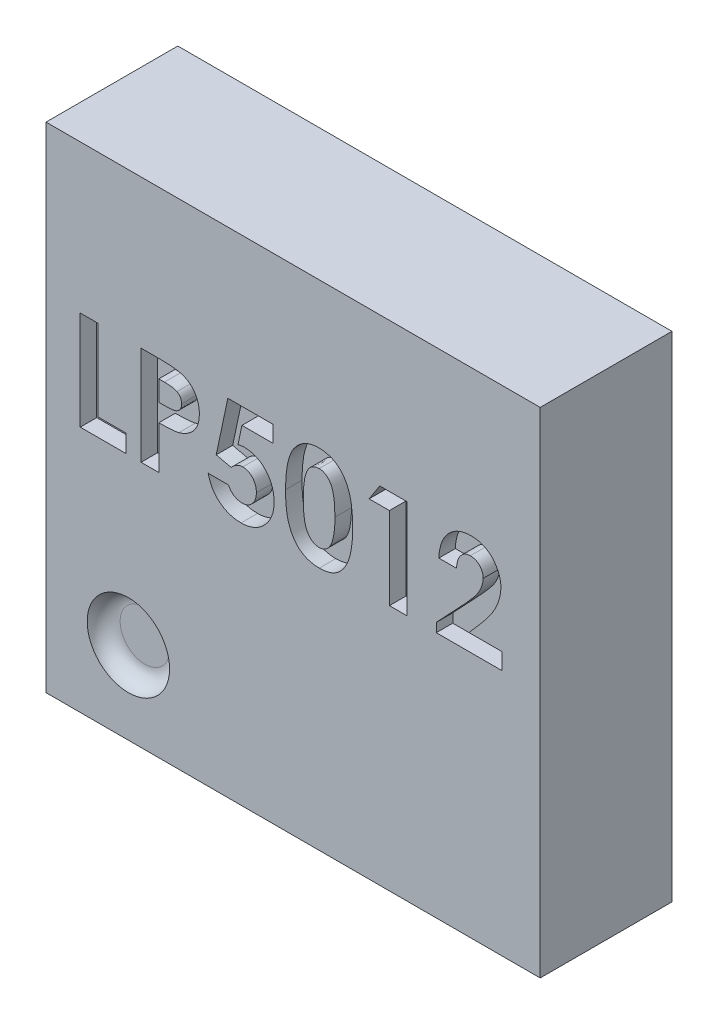
from build123d import *

# Parameters (mm, degrees)
CROQUIS1_W              = 3
CROQUIS1_H              = 3
SALIENTE_EXTRUIR1_DEPTH = 0.8
CROQUIS2_R              = 0.25
CORTAR_EXTRUIR1_DEPTH   = 0.1
REDONDEO1_R             = 0.1


with BuildPart() as part:
    # Croquis1 → Saliente-Extruir1 (new body)
    with BuildSketch(Plane.XY):
        Rectangle(CROQUIS1_W, CROQUIS1_H)
    extrude(amount=SALIENTE_EXTRUIR1_DEPTH)

    # Croquis2 → Cortar-Extruir1 (cut)
    # profile 1 of 7: a face of its own
    with BuildSketch(Plane.XY.offset(0.8)):
        with Locations((-1, -1)):
            Circle(CROQUIS2_R)
    # profile 2 of 7: a face of its own
    with BuildSketch(Plane.XY.offset(0.8)):
        Polygon((-1.292307692, 0.6), (-1.184615385, 0.6), (-1.184615385, 0.107692308), (-1.015384615, 0.107692308), (-1.015384615, 0), (-1.292307692, 0), align=None)
    # profile 3 of 7: a face of its own
    with BuildSketch(Plane.XY.offset(0.8)):
        with BuildLine():
            Line((-0.923076923, 0.6), (-0.802884615, 0.6))
            add(Edge.make_bspline(
                [(-0.802884615, 0.6), (-0.795031406, 0.599964847), (-0.779880919, 0.599897031), (-0.75803267, 0.599074662), (-0.73787659, 0.597600926), (-0.719417311, 0.595779623), (-0.702662422, 0.593226226), (-0.687590942, 0.590298956), (-0.674199742, 0.586732689), (-0.662337817, 0.58249958), (-0.651692122, 0.57750891), (-0.641617862, 0.57219349), (-0.632342714, 0.565849724), (-0.623398536, 0.559161316), (-0.61529668, 0.551489325), (-0.607531704, 0.543344333), (-0.600432478, 0.534403315), (-0.593966104, 0.524774502), (-0.588100106, 0.514635792), (-0.582975179, 0.503969061), (-0.578818124, 0.492757428), (-0.575330872, 0.481073421), (-0.572529878, 0.468917549), (-0.570665447, 0.456215053), (-0.569399031, 0.443054625), (-0.569287288, 0.434097629), (-0.569230769, 0.429567308)],
                knots=[0, 0, 0, 0, 1.698747864, 3.27724071, 4.728299578, 6.070144658, 7.288476769, 8.393259625, 9.389771311, 10.283485332, 11.113357557, 11.931608583, 12.74405601, 13.541433047, 14.344816069, 15.154114104, 15.974336324, 16.810834471, 17.661136416, 18.50621059, 19.367396281, 20.244825668, 21.142564693, 22.063065223, 23.020325768, 24, 24, 24, 24], degree=3))
            add(Edge.make_bspline(
                [(-0.569230769, 0.429567308), (-0.569312544, 0.424555521), (-0.569473242, 0.414706743), (-0.5710486, 0.400269644), (-0.573739808, 0.386505177), (-0.577257077, 0.373297264), (-0.582161659, 0.360863204), (-0.587764912, 0.348906318), (-0.594658692, 0.337761838), (-0.602535937, 0.327290363), (-0.611138788, 0.317406752), (-0.620671474, 0.308396377), (-0.630952301, 0.300197815), (-0.641921755, 0.292725144), (-0.653621018, 0.285993438), (-0.66604165, 0.279939661), (-0.679268466, 0.274757433), (-0.688479223, 0.272047169), (-0.693149038, 0.270673077)],
                knots=[0, 0, 0, 0, 1.102006807, 2.165578795, 3.188629044, 4.184801286, 5.166646146, 6.124351954, 7.085497154, 8.042432466, 9.003981491, 9.963833307, 10.922997304, 11.89326795, 12.880200226, 13.889073926, 14.929769137, 16, 16, 16, 16], degree=3))
            add(Edge.make_bspline(
                [(-0.693149038, 0.270673077), (-0.696224848, 0.269907811), (-0.702888041, 0.268249997), (-0.713913796, 0.266566901), (-0.726619821, 0.265019397), (-0.741047203, 0.263689505), (-0.757204259, 0.262785488), (-0.775075346, 0.262079491), (-0.794668562, 0.261566158), (-0.80829291, 0.261547943), (-0.815384615, 0.261538462)],
                knots=[0, 0, 0, 0, 0.618981996, 1.340914327, 2.176866532, 3.120127938, 4.170906482, 5.338178032, 6.614476169, 8, 8, 8, 8], degree=3))
            Line((-0.815384615, 0.261538462), (-0.815384615, 0))
            Line((-0.815384615, 0), (-0.923076923, 0))
            Line((-0.923076923, 0), (-0.923076923, 0.6))
        make_face()
        with BuildLine():
            Line((-0.815384615, 0.369230769), (-0.777283654, 0.369230769))
            add(Edge.make_bspline(
                [(-0.777283654, 0.369230769), (-0.770350582, 0.36927473), (-0.757593628, 0.369355619), (-0.740172133, 0.370525321), (-0.726171884, 0.372311692), (-0.715111428, 0.374873761), (-0.70637815, 0.37876204), (-0.698846245, 0.383260047), (-0.692385937, 0.388947653), (-0.686792262, 0.395446717), (-0.682320287, 0.402914466), (-0.679219205, 0.411229304), (-0.677204804, 0.420216526), (-0.677018755, 0.426471038), (-0.676923077, 0.4296875)],
                knots=[0, 0, 0, 0, 1.8619151, 3.425951444, 4.686033666, 5.651700536, 6.461346321, 7.243864085, 7.999046032, 8.762387399, 9.539336099, 10.322741239, 11.137448474, 12, 12, 12, 12], degree=3))
            add(Edge.make_bspline(
                [(-0.676923077, 0.4296875), (-0.677017771, 0.432497681), (-0.677201499, 0.437950107), (-0.678551219, 0.445819311), (-0.680702285, 0.453155033), (-0.683819097, 0.459880659), (-0.687848396, 0.465984764), (-0.692760928, 0.471464942), (-0.698493654, 0.476438555), (-0.702919653, 0.479071164), (-0.705168269, 0.480408654)],
                knots=[0, 0, 0, 0, 1.102301479, 2.1387299, 3.123554645, 4.094223062, 5.036071848, 5.982632524, 6.975082478, 8, 8, 8, 8], degree=3))
            add(Edge.make_bspline(
                [(-0.705168269, 0.480408654), (-0.707072977, 0.481371919), (-0.711105633, 0.483411349), (-0.717973637, 0.485782335), (-0.725899209, 0.487782523), (-0.734935855, 0.48944266), (-0.745047526, 0.490731098), (-0.756232417, 0.491716432), (-0.768506988, 0.492112672), (-0.777043218, 0.492240893), (-0.781490385, 0.492307692)],
                knots=[0, 0, 0, 0, 0.656809284, 1.390599849, 2.23162475, 3.173112763, 4.218524733, 5.370385145, 6.63003504, 8, 8, 8, 8], degree=3))
            Line((-0.781490385, 0.492307692), (-0.815384615, 0.492307692))
            Line((-0.815384615, 0.492307692), (-0.815384615, 0.369230769))
        make_face(mode=Mode.SUBTRACT)
    # profile 4 of 7: a face of its own
    with BuildSketch(Plane.XY.offset(0.8)):
        with BuildLine():
            Line((-0.396274038, 0.6), (-0.123076923, 0.6))
            Line((-0.123076923, 0.6), (-0.123076923, 0.5))
            Line((-0.123076923, 0.5), (-0.3109375, 0.5))
            Line((-0.3109375, 0.5), (-0.334375, 0.386538462))
            add(Edge.make_bspline(
                [(-0.334375, 0.386538462), (-0.331181305, 0.387427946), (-0.324882683, 0.389182192), (-0.3153938, 0.390941478), (-0.306197751, 0.392081792), (-0.300163359, 0.392233895), (-0.297235577, 0.392307692)],
                knots=[0, 0, 0, 0, 1.05461699, 2.079921384, 3.068411212, 4, 4, 4, 4], degree=3))
            add(Edge.make_bspline(
                [(-0.297235577, 0.392307692), (-0.290855633, 0.3921615), (-0.278279359, 0.391873322), (-0.259881865, 0.389137572), (-0.242265179, 0.384828849), (-0.225483207, 0.378683722), (-0.209552346, 0.37068568), (-0.194453282, 0.361010291), (-0.180167485, 0.349640561), (-0.16694873, 0.336569373), (-0.154802786, 0.322216913), (-0.14424258, 0.306693208), (-0.135223505, 0.290219613), (-0.128050045, 0.272693726), (-0.122388139, 0.254225623), (-0.118296719, 0.234803468), (-0.115877258, 0.214404245), (-0.115551009, 0.200487313), (-0.115384615, 0.193389423)],
                knots=[0, 0, 0, 0, 1.01440847, 1.999622559, 2.951875003, 3.895578053, 4.836219714, 5.782137149, 6.743708247, 7.735272588, 8.734977101, 9.730283169, 10.717124674, 11.717316708, 12.737475749, 13.78628267, 14.87096371, 16, 16, 16, 16], degree=3))
            add(Edge.make_bspline(
                [(-0.115384615, 0.193389423), (-0.115587951, 0.186210956), (-0.11598919, 0.172045742), (-0.118606912, 0.151217867), (-0.123227237, 0.131269465), (-0.129573716, 0.112147134), (-0.137934796, 0.093991418), (-0.14799014, 0.076614239), (-0.159909754, 0.060144582), (-0.173576669, 0.04475128), (-0.188434398, 0.030681506), (-0.204254371, 0.0183043), (-0.22092545, 0.00788898), (-0.238448036, -0.000528359), (-0.256721597, -0.007188007), (-0.275751678, -0.012035913), (-0.295630765, -0.014815918), (-0.309126081, -0.015192967), (-0.315985577, -0.015384615)],
                knots=[0, 0, 0, 0, 1.06808661, 2.107647099, 3.116961351, 4.110378221, 5.100014249, 6.085620622, 7.093190682, 8.119403071, 9.144090782, 10.133780668, 11.103064255, 12.062861538, 13.020824475, 13.992378307, 14.979551724, 16, 16, 16, 16], degree=3))
            add(Edge.make_bspline(
                [(-0.315985577, -0.015384615), (-0.32211982, -0.015227835), (-0.334217831, -0.014918631), (-0.352037669, -0.013018098), (-0.369217972, -0.00965794), (-0.385667532, -0.00479492), (-0.401559424, 0.001190347), (-0.416709934, 0.008676054), (-0.431202317, 0.017519664), (-0.44499542, 0.02755978), (-0.457865125, 0.038869582), (-0.469611227, 0.051250109), (-0.48030484, 0.064545309), (-0.489717137, 0.078919207), (-0.497818613, 0.094350565), (-0.505003167, 0.110657521), (-0.510883797, 0.128010371), (-0.513868047, 0.140040331), (-0.515384615, 0.146153846)],
                knots=[0, 0, 0, 0, 1.054957082, 2.080596141, 3.077793124, 4.061112343, 5.027190972, 5.994718051, 6.962465889, 7.943658696, 8.924948258, 9.904494768, 10.875059, 11.855380583, 12.854004648, 13.869083016, 14.917087635, 16, 16, 16, 16], degree=3))
            Line((-0.515384615, 0.146153846), (-0.392307692, 0.146153846))
            add(Edge.make_bspline(
                [(-0.392307692, 0.146153846), (-0.390057843, 0.141917429), (-0.385685518, 0.133684437), (-0.377368389, 0.122753902), (-0.368057892, 0.113432812), (-0.357838011, 0.105630096), (-0.346642528, 0.099784435), (-0.334927639, 0.095351356), (-0.322546174, 0.092789643), (-0.31411385, 0.092469404), (-0.309855769, 0.092307692)],
                knots=[0, 0, 0, 0, 1.104910296, 2.147267069, 3.153527244, 4.136738762, 5.099945312, 6.05603338, 7.018353, 8, 8, 8, 8], degree=3))
            add(Edge.make_bspline(
                [(-0.309855769, 0.092307692), (-0.306887944, 0.092419356), (-0.301048699, 0.092639055), (-0.292445494, 0.09380132), (-0.284233357, 0.096002624), (-0.276351233, 0.099050919), (-0.268777948, 0.102852486), (-0.261622067, 0.107651717), (-0.254759092, 0.11317581), (-0.248293505, 0.119514725), (-0.242437547, 0.126581141), (-0.237302512, 0.134174487), (-0.232711083, 0.142126037), (-0.229310141, 0.150750772), (-0.226525057, 0.159791153), (-0.224474008, 0.169315376), (-0.223248276, 0.179334565), (-0.223134806, 0.186174384), (-0.223076923, 0.189663462)],
                knots=[0, 0, 0, 0, 0.978869489, 1.925942215, 2.855067702, 3.774946051, 4.70828698, 5.642468714, 6.60995405, 7.609372294, 8.622401667, 9.629904756, 10.629323, 11.642352373, 12.678539694, 13.745912462, 14.850161547, 16, 16, 16, 16], degree=3))
            add(Edge.make_bspline(
                [(-0.223076923, 0.189663462), (-0.223144102, 0.19307155), (-0.223274869, 0.199705477), (-0.224356593, 0.209446458), (-0.226291777, 0.218688886), (-0.228928482, 0.227503551), (-0.232303779, 0.235836926), (-0.236428618, 0.243738616), (-0.241320619, 0.25116868), (-0.247006049, 0.25797585), (-0.253068932, 0.26421958), (-0.259582417, 0.269680297), (-0.26648782, 0.274212312), (-0.273570565, 0.278168893), (-0.281113369, 0.281048407), (-0.288946626, 0.283031422), (-0.297062096, 0.284486478), (-0.302597482, 0.284571968), (-0.305408654, 0.284615385)],
                knots=[0, 0, 0, 0, 1.166249705, 2.270133367, 3.348514167, 4.393962215, 5.415026464, 6.420877785, 7.440098956, 8.453121383, 9.451844239, 10.415694839, 11.355045125, 12.27538808, 13.187007209, 14.108269027, 15.039275622, 16, 16, 16, 16], degree=3))
            add(Edge.make_bspline(
                [(-0.305408654, 0.284615385), (-0.30846224, 0.284499518), (-0.314582281, 0.284267296), (-0.32367513, 0.282377772), (-0.332658344, 0.279319812), (-0.341581881, 0.275100871), (-0.350357156, 0.26957961), (-0.359215756, 0.263103803), (-0.367861163, 0.255202922), (-0.373358154, 0.249318328), (-0.376201923, 0.246274038)],
                knots=[0, 0, 0, 0, 0.88288272, 1.769486374, 2.674910571, 3.623812639, 4.617874466, 5.670434592, 6.794841017, 8, 8, 8, 8], degree=3))
            Line((-0.376201923, 0.246274038), (-0.466826923, 0.267067308))
            Line((-0.466826923, 0.267067308), (-0.396274038, 0.6))
        make_face()
    # profile 5 of 7: a face of its own
    with BuildSketch(Plane.XY.offset(0.8)):
        with BuildLine():
            add(Edge.make_bspline(
                [(0.155889423, 0.615384615), (0.161102178, 0.615307231), (0.171351846, 0.615155071), (0.186447678, 0.613507063), (0.200989139, 0.611017382), (0.215033115, 0.607545146), (0.228478517, 0.602949764), (0.241423203, 0.597449171), (0.253713095, 0.59075485), (0.265504927, 0.583193269), (0.276794158, 0.574632489), (0.287309458, 0.564872757), (0.297242859, 0.554138645), (0.30637934, 0.542267874), (0.314921231, 0.529368419), (0.322840465, 0.515438237), (0.330076418, 0.500409148), (0.336710187, 0.48425403), (0.342642124, 0.466730726), (0.347638588, 0.447638235), (0.351923892, 0.426972198), (0.35554099, 0.404681173), (0.358274932, 0.380735531), (0.360117664, 0.35515118), (0.361382234, 0.327977442), (0.361485439, 0.309336481), (0.361538462, 0.299759615)],
                knots=[0, 0, 0, 0, 0.879237366, 1.728815576, 2.559023295, 3.367336655, 4.166867292, 4.954216142, 5.737608147, 6.525189134, 7.316157332, 8.124696809, 8.942788509, 9.781158001, 10.649253743, 11.551476218, 12.482711956, 13.461909668, 14.496590415, 15.601789533, 16.789733467, 18.056700938, 19.410929216, 20.8549011, 22.384193279, 24, 24, 24, 24], degree=3))
            add(Edge.make_bspline(
                [(0.361538462, 0.299759615), (0.361481159, 0.290062932), (0.361369821, 0.271222451), (0.360170233, 0.243800169), (0.358104485, 0.21803006), (0.355442, 0.19391479), (0.351795125, 0.171467095), (0.347524126, 0.15062885), (0.342448795, 0.131407608), (0.336321461, 0.113846679), (0.329727846, 0.097663189), (0.3224721, 0.082663403), (0.31468069, 0.068806692), (0.306532326, 0.055884009), (0.297580287, 0.044276309), (0.288260292, 0.033588869), (0.278166533, 0.024228787), (0.267723995, 0.015713687), (0.256550127, 0.008354932), (0.244760162, 0.001919086), (0.232143905, -0.00330115), (0.218931328, -0.007841432), (0.204897222, -0.011100865), (0.190264585, -0.013687118), (0.174868219, -0.01511644), (0.164385753, -0.015293756), (0.159014423, -0.015384615)],
                knots=[0, 0, 0, 0, 1.643780988, 3.193836972, 4.651895693, 6.025988579, 7.305620092, 8.505800249, 9.631074763, 10.672816429, 11.65661981, 12.592235626, 13.49536222, 14.350718032, 15.179365177, 15.97804903, 16.751647189, 17.51006938, 18.259804725, 19.016521909, 19.783502495, 20.571750527, 21.382245291, 22.22305063, 23.089471752, 24, 24, 24, 24], degree=3))
            add(Edge.make_bspline(
                [(0.159014423, -0.015384615), (0.153643238, -0.015292004), (0.143121165, -0.015110579), (0.127683166, -0.013697745), (0.112972984, -0.011090388), (0.098827845, -0.007816409), (0.085346198, -0.003311196), (0.072463397, 0.002065225), (0.060278502, 0.008460915), (0.048757773, 0.015836816), (0.037940546, 0.024294944), (0.027658721, 0.033744829), (0.017935043, 0.04416252), (0.008917431, 0.055664703), (0.000458205, 0.068097847), (-0.00735442, 0.081603933), (-0.014515748, 0.096163296), (-0.021249788, 0.111796232), (-0.027100816, 0.128839298), (-0.032307959, 0.147444687), (-0.036573513, 0.167767491), (-0.040004158, 0.189801181), (-0.042743183, 0.213499077), (-0.044780702, 0.238872618), (-0.045986954, 0.265933622), (-0.046097124, 0.284533998), (-0.046153846, 0.294110577)],
                knots=[0, 0, 0, 0, 0.917216111, 1.796812873, 2.643793957, 3.46689424, 4.273913431, 5.068098542, 5.848489301, 6.620921603, 7.401012384, 8.190319798, 9.003608147, 9.831726257, 10.68377682, 11.569763213, 12.493818149, 13.453288342, 14.474581811, 15.568529029, 16.750744269, 18.018426408, 19.375425659, 20.823733699, 22.36466933, 24, 24, 24, 24], degree=3))
            add(Edge.make_bspline(
                [(-0.046153846, 0.294110577), (-0.046051099, 0.30741648), (-0.045852847, 0.33309039), (-0.043340455, 0.370181726), (-0.039652901, 0.404466241), (-0.034236757, 0.435886585), (-0.02753977, 0.464559131), (-0.01896393, 0.490294998), (-0.009200959, 0.5134503), (-0.000881654, 0.527167641), (0.003125, 0.533774038)],
                knots=[0, 0, 0, 0, 1.288568992, 2.486310467, 3.599230591, 4.627010532, 5.572937695, 6.447898582, 7.252493626, 8, 8, 8, 8], degree=3))
            add(Edge.make_bspline(
                [(0.003125, 0.533774038), (0.007783747, 0.540264162), (0.016892514, 0.552953631), (0.032819449, 0.569612533), (0.049930867, 0.583860041), (0.068578226, 0.595373722), (0.088466612, 0.604453412), (0.109766775, 0.610866295), (0.132400059, 0.614602739), (0.147942712, 0.615120098), (0.155889423, 0.615384615)],
                knots=[0, 0, 0, 0, 1.058512271, 2.069600068, 3.047294572, 4.004278952, 4.967380941, 5.939006123, 6.946246673, 8, 8, 8, 8], degree=3))
        make_face()
        with BuildLine():
            add(Edge.make_bspline(
                [(0.158533654, 0.507692308), (0.15382128, 0.507468951), (0.144582527, 0.507031052), (0.131176656, 0.503313911), (0.118535756, 0.497572587), (0.108920161, 0.4906638), (0.101722984, 0.4840409), (0.096694265, 0.478047391), (0.091844858, 0.471359067), (0.087561617, 0.463674117), (0.08351712, 0.455268673), (0.079564427, 0.446104577), (0.076324257, 0.43595674), (0.073140875, 0.42499798), (0.070351936, 0.412925318), (0.068015417, 0.399640072), (0.065927942, 0.385055848), (0.064471903, 0.369163092), (0.063114438, 0.351978433), (0.062141343, 0.333463589), (0.061734517, 0.313623556), (0.061605199, 0.29996002), (0.061538462, 0.292908654)],
                knots=[0, 0, 0, 0, 1.076674018, 2.110852608, 3.161083442, 4.239746716, 4.804137807, 5.395870207, 6.026861976, 6.692161227, 7.405688833, 8.16177676, 8.973626916, 9.841385931, 10.773283133, 11.807421078, 12.927755683, 14.143907515, 15.458935494, 16.872852025, 18.386167141, 20, 20, 20, 20], degree=3))
            add(Edge.make_bspline(
                [(0.061538462, 0.292908654), (0.061648303, 0.283773269), (0.061858932, 0.26625549), (0.062962109, 0.241064315), (0.065173336, 0.218138317), (0.067923655, 0.197322118), (0.071786592, 0.178750717), (0.07623115, 0.162248412), (0.081719784, 0.148025566), (0.088062958, 0.135876486), (0.095088309, 0.125541288), (0.102714637, 0.116756324), (0.110682293, 0.109148959), (0.119239972, 0.10296959), (0.128367259, 0.098234007), (0.137987958, 0.094827761), (0.148108182, 0.092742655), (0.155038407, 0.092453518), (0.158533654, 0.092307692)],
                knots=[0, 0, 0, 0, 1.771748488, 3.397459088, 4.888034009, 6.237357457, 7.467047327, 8.564189669, 9.548206622, 10.417051504, 11.216568818, 11.965764335, 12.669334354, 13.348544111, 14.005342236, 14.656555988, 15.322436492, 16, 16, 16, 16], degree=3))
            add(Edge.make_bspline(
                [(0.158533654, 0.092307692), (0.161908954, 0.092407477), (0.168517373, 0.092602843), (0.178153928, 0.094608252), (0.187266939, 0.09786861), (0.195828891, 0.102480616), (0.203870409, 0.108345488), (0.211352191, 0.115488997), (0.218217811, 0.123982348), (0.222217752, 0.130285671), (0.224278846, 0.133533654)],
                knots=[0, 0, 0, 0, 0.992283464, 1.942767638, 2.88273346, 3.832339453, 4.79467288, 5.803907806, 6.868395428, 8, 8, 8, 8], degree=3))
            add(Edge.make_bspline(
                [(0.224278846, 0.133533654), (0.226705437, 0.137971918), (0.231793801, 0.147278598), (0.237682065, 0.162983274), (0.242638477, 0.180695553), (0.246904389, 0.200470557), (0.249822012, 0.222386282), (0.252334666, 0.246303757), (0.253546581, 0.272343421), (0.253743706, 0.290383795), (0.253846154, 0.299759615)],
                knots=[0, 0, 0, 0, 0.710965849, 1.490837728, 2.352621235, 3.297892224, 4.334225155, 5.461620853, 6.680770821, 8, 8, 8, 8], degree=3))
            add(Edge.make_bspline(
                [(0.253846154, 0.299759615), (0.25380658, 0.309216823), (0.253730408, 0.327420332), (0.252332866, 0.353553611), (0.250386683, 0.377422024), (0.247539978, 0.398972283), (0.243877174, 0.418256702), (0.239362755, 0.435274021), (0.234040591, 0.450057777), (0.227729139, 0.462593229), (0.220738814, 0.473246644), (0.21331837, 0.482386448), (0.205436431, 0.490189782), (0.197106178, 0.496686011), (0.188134804, 0.501649617), (0.178693675, 0.505154334), (0.168763436, 0.50727457), (0.161989607, 0.507551182), (0.158533654, 0.507692308)],
                knots=[0, 0, 0, 0, 1.793836731, 3.452829483, 4.963243077, 6.335886805, 7.574563692, 8.684454726, 9.672768357, 10.54971625, 11.340229787, 12.085688095, 12.778991901, 13.440269426, 14.083255152, 14.715733572, 15.344777694, 16, 16, 16, 16], degree=3))
        make_face(mode=Mode.SUBTRACT)
    # profile 6 of 7: a face of its own
    with BuildSketch(Plane.XY.offset(0.8)):
        Polygon((0.525841346, 0.6), (0.692307692, 0.6), (0.692307692, 0), (0.584615385, 0), (0.584615385, 0.5), (0.461538462, 0.5), align=None)
    # profile 7 of 7: a face of its own
    with BuildSketch(Plane.XY.offset(0.8)):
        with BuildLine():
            Line((0.992307692, 0.4), (0.884615385, 0.4))
            add(Edge.make_bspline(
                [(0.884615385, 0.4), (0.885080491, 0.408146353), (0.885989281, 0.424063839), (0.88960422, 0.447184496), (0.894448113, 0.469030974), (0.900912931, 0.489526853), (0.909036398, 0.508664684), (0.918609476, 0.526509709), (0.929876736, 0.542967975), (0.942598373, 0.557960109), (0.956558409, 0.571409691), (0.971467019, 0.583334936), (0.987552252, 0.593175347), (1.004520216, 0.601273095), (1.022368023, 0.607742819), (1.04126454, 0.612068353), (1.061046152, 0.614997647), (1.074588267, 0.615253972), (1.081490385, 0.615384615)],
                knots=[0, 0, 0, 0, 1.199038563, 2.342849363, 3.436047546, 4.486744587, 5.497670872, 6.488682221, 7.459191391, 8.424610317, 9.374430501, 10.305433194, 11.225809216, 12.140057399, 13.06607119, 14.010487599, 14.985989317, 16, 16, 16, 16], degree=3))
            add(Edge.make_bspline(
                [(1.081490385, 0.615384615), (1.089962637, 0.615120259), (1.106502458, 0.614604173), (1.13053613, 0.610201788), (1.152980952, 0.602838118), (1.173820608, 0.59254913), (1.192877688, 0.57947805), (1.21014903, 0.563892925), (1.225112322, 0.545466773), (1.237862436, 0.524966274), (1.248456257, 0.503259132), (1.255879965, 0.480813047), (1.260759488, 0.458223646), (1.26127992, 0.443013088), (1.261538462, 0.435456731)],
                knots=[0, 0, 0, 0, 1.075374347, 2.099382735, 3.09057751, 4.06680945, 5.040638231, 6.016817125, 7.011024321, 8.044445721, 9.0776792, 10.070479129, 11.0414456, 12, 12, 12, 12], degree=3))
            add(Edge.make_bspline(
                [(1.261538462, 0.435456731), (1.261437799, 0.430886112), (1.26123519, 0.421686586), (1.259826424, 0.407765445), (1.257712997, 0.393585135), (1.254526464, 0.379157815), (1.250552596, 0.36447944), (1.24573172, 0.349506083), (1.23995201, 0.334322638), (1.233309919, 0.318758217), (1.225385888, 0.302762289), (1.216159455, 0.286095068), (1.205385729, 0.268771341), (1.193194845, 0.250693291), (1.179527593, 0.23188943), (1.164317254, 0.212416401), (1.147739017, 0.192205588), (1.135972975, 0.178695794), (1.129927885, 0.171754808)],
                knots=[0, 0, 0, 0, 0.728284026, 1.46585585, 2.227944881, 3.01186502, 3.81876927, 4.650621989, 5.517437689, 6.406905708, 7.346299482, 8.360816762, 9.441613733, 10.596154504, 11.834900912, 13.145207542, 14.533280747, 16, 16, 16, 16], degree=3))
            Line((1.129927885, 0.171754808), (1.067307692, 0.1))
            Line((1.067307692, 0.1), (1.269230769, 0.1))
            Line((1.269230769, 0.1), (1.269230769, 0))
            Line((1.269230769, 0), (0.869230769, 0))
            Line((0.869230769, 0), (0.869230769, 0.054567308))
            Line((0.869230769, 0.054567308), (1.046875, 0.243629808))
            add(Edge.make_bspline(
                [(1.046875, 0.243629808), (1.052018257, 0.24914482), (1.061979221, 0.259825762), (1.076152645, 0.275511862), (1.088978342, 0.290397597), (1.100190361, 0.304641469), (1.110377093, 0.317781466), (1.119084314, 0.330213642), (1.126391686, 0.341825608), (1.134324876, 0.35582761), (1.141858798, 0.372527489), (1.148771628, 0.391766435), (1.152985476, 0.410154437), (1.15356712, 0.422136454), (1.153846154, 0.427884615)],
                knots=[0, 0, 0, 0, 1.246127091, 2.413378631, 3.493388633, 4.492180848, 5.408488754, 6.240484944, 6.999099869, 7.674939598, 8.898438119, 10.020720584, 11.050475521, 12, 12, 12, 12], degree=3))
            add(Edge.make_bspline(
                [(1.153846154, 0.427884615), (1.153637527, 0.433445518), (1.153233279, 0.44422066), (1.148790925, 0.459548241), (1.141908676, 0.473425801), (1.132210615, 0.485438663), (1.120463225, 0.495310428), (1.106888013, 0.50265277), (1.091595656, 0.506889267), (1.080875423, 0.507419525), (1.075360577, 0.507692308)],
                knots=[0, 0, 0, 0, 1.062038974, 2.057870785, 3.028805853, 4.01125022, 4.991535629, 5.949134679, 6.94496649, 8, 8, 8, 8], degree=3))
            add(Edge.make_bspline(
                [(1.075360577, 0.507692308), (1.072511537, 0.507591539), (1.066902746, 0.507393158), (1.05865826, 0.506072595), (1.05081304, 0.503745241), (1.043279763, 0.500626913), (1.036138827, 0.496493547), (1.029408244, 0.491398515), (1.023017097, 0.485471294), (1.0169947, 0.478730416), (1.011513533, 0.471207594), (1.00664518, 0.462971535), (1.002619862, 0.454027349), (0.999075827, 0.444493115), (0.996342497, 0.434266426), (0.994352294, 0.423408488), (0.992839275, 0.411936966), (0.99248811, 0.404051374), (0.992307692, 0.4)],
                knots=[0, 0, 0, 0, 0.903469896, 1.778625579, 2.63899355, 3.493148037, 4.358286772, 5.247621495, 6.164656832, 7.118446693, 8.109501108, 9.111810964, 10.146451449, 11.215617525, 12.33435995, 13.498009769, 14.714554818, 16, 16, 16, 16], degree=3))
        make_face()
    extrude(amount=-CORTAR_EXTRUIR1_DEPTH, mode=Mode.SUBTRACT)

    # Redondeo1
    redondeo1_edges = [part.edges().sort_by_distance(p)[0] for p in [
        (-1.25, -1, 0.7),
    ]]
    fillet(redondeo1_edges, radius=REDONDEO1_R - 0.0001)  # a hair under: the kernel refuses the full size


solid = part.part
